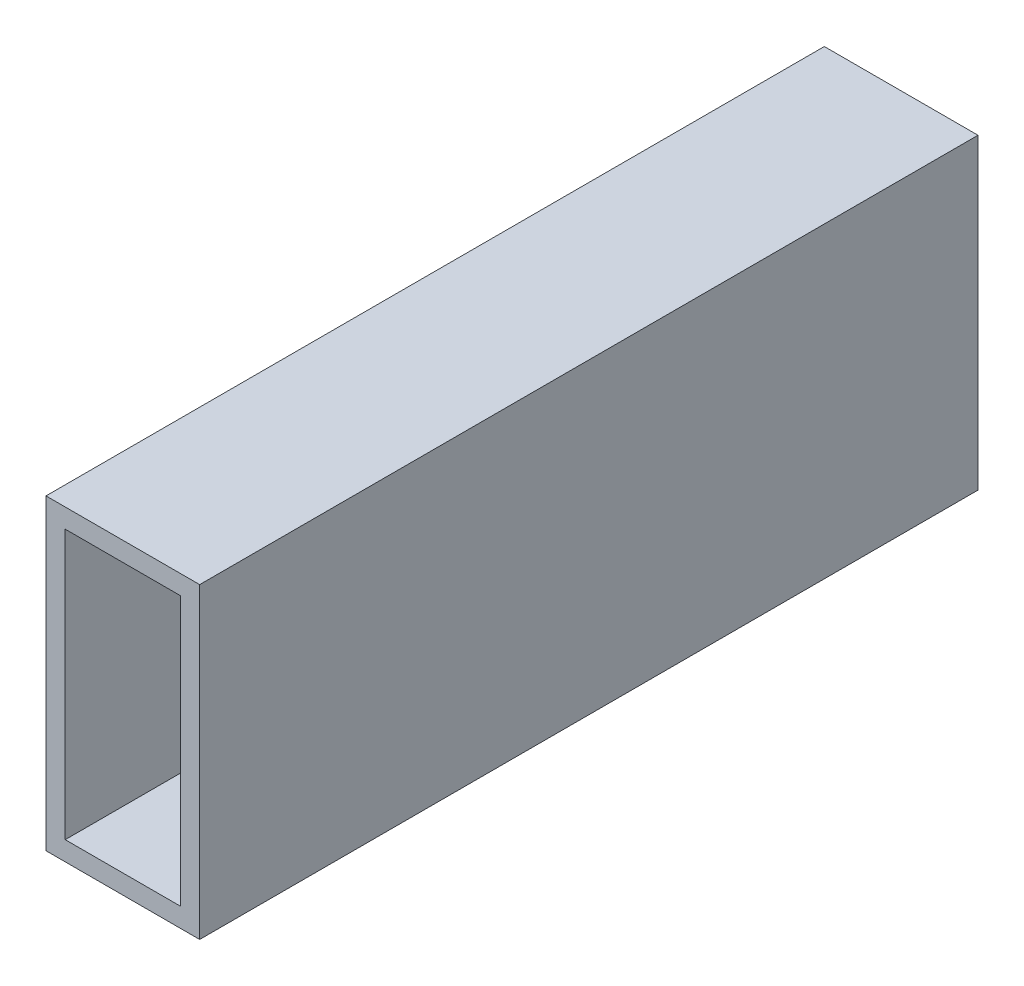
from build123d import *

# Parameters (mm, degrees)
SKETCH1_W           = 25.4
SKETCH1_H           = 50.8
SKETCH1_W_2         = 19.05
SKETCH1_H_2         = 44.45
BOSS_EXTRUDE1_DEPTH = 128.651


with BuildPart() as part:
    # Sketch1 → Boss-Extrude1 (new body)
    with BuildSketch(Plane.XY):
        with Locations((12.7, 25.4)):
            Rectangle(SKETCH1_W, SKETCH1_H)
        with Locations((12.7, 25.4)):
            Rectangle(SKETCH1_W_2, SKETCH1_H_2, mode=Mode.SUBTRACT)
    extrude(amount=BOSS_EXTRUDE1_DEPTH)


solid = part.part
